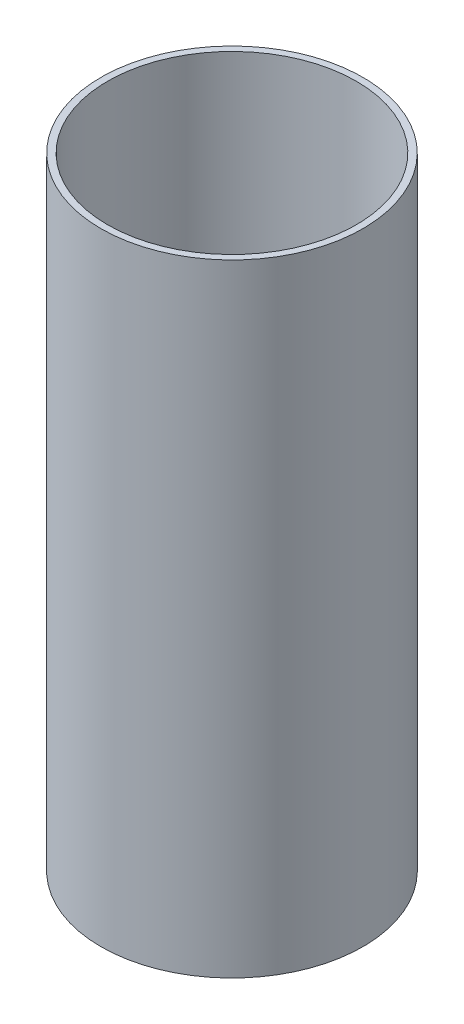
from build123d import *

# Parameters (mm, degrees)
SKETCH1_R           = 93.6625
SKETCH1_R_2         = 88.9
BOSS_EXTRUDE1_DEPTH = 222.25


with BuildPart() as part:
    # Sketch1 → Boss-Extrude1 (new, symmetric)
    with BuildSketch(Plane(origin=(0, 0, 0), x_dir=(1, 0, 0), z_dir=(0, 1, 0))):
        Circle(SKETCH1_R)
        Circle(SKETCH1_R_2, mode=Mode.SUBTRACT)
    extrude(amount=BOSS_EXTRUDE1_DEPTH, both=True)


solid = part.part
